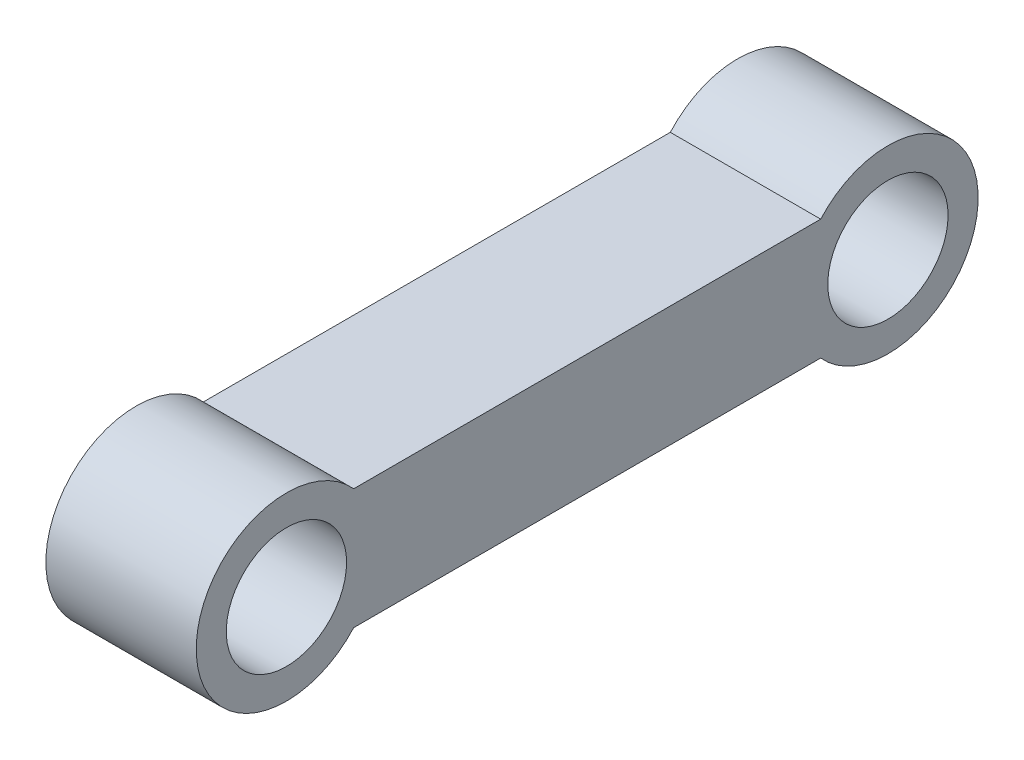
from build123d import *

# Parameters (mm, degrees)
LINKFRAME_R         = 40
BOSS_EXTRUDE1_DEPTH = 100


with BuildPart() as part:
    # LinkFrame → Boss-Extrude1 (new body)
    with BuildSketch(Plane(origin=(0, 0, 0), x_dir=(0, 0, -1), z_dir=(1, 0, 0))):
        with BuildLine():
            Line((-149.770813276, 585.351876291), (160.786467624, 585.351876291))
            ThreePointArc((160.786467624, 585.351876291), (265.507827174, 545.351876291), (160.786467624, 505.351876291))
            Line((160.786467624, 505.351876291), (-149.770813276, 505.351876291))
            ThreePointArc((-149.770813276, 505.351876291), (-254.492172826, 545.351876291), (-149.770813276, 585.351876291))
        make_face()
        with Locations((-194.492172826, 545.351876291)):
            Circle(LINKFRAME_R, mode=Mode.SUBTRACT)
        with Locations((205.507827174, 545.351876291)):
            Circle(LINKFRAME_R, mode=Mode.SUBTRACT)
    extrude(amount=BOSS_EXTRUDE1_DEPTH)


solid = part.part
